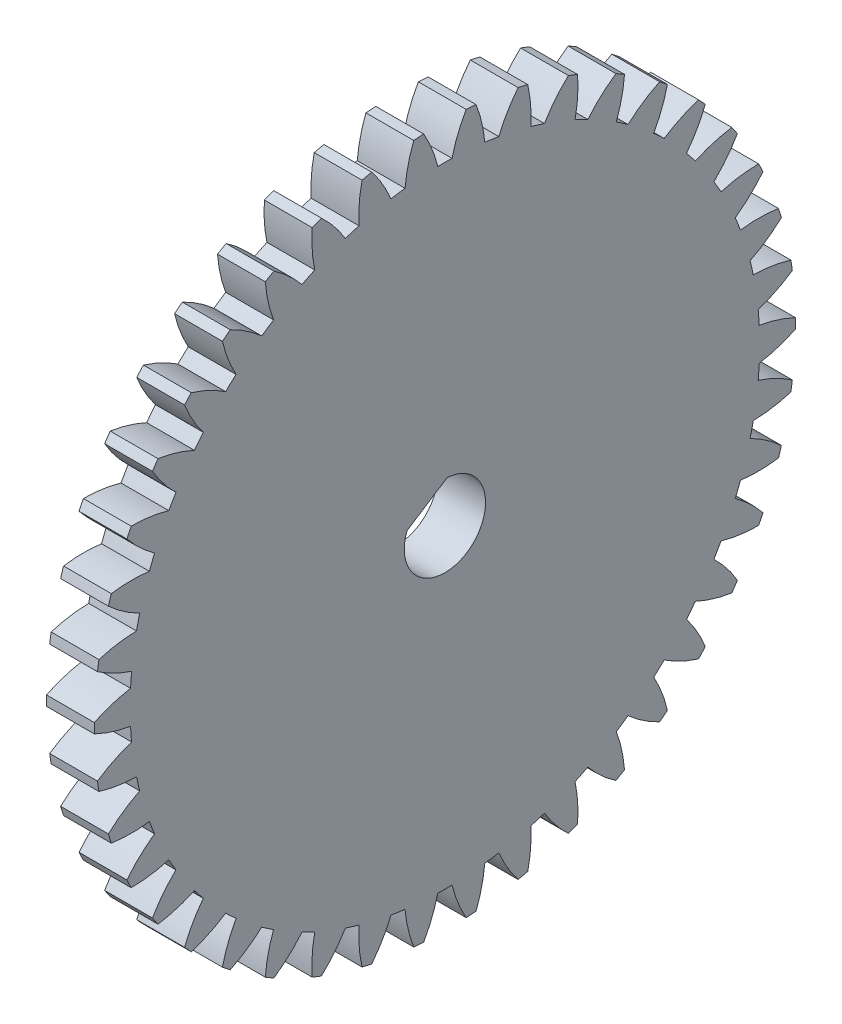
from build123d import *

# Parameters (mm, degrees)
BASPROSKE_W     = 3
BASPROSKE_H     = 22
TOOTHCUT_DEPTH  = 32.256999216
TEETHCUTS_COUNT = 42
TEETHCUTS_ANGLE = 351.428571429
BORE_DEPTH      = 50.0000508


with BuildPart() as part:
    # BasProSke → Base-Revolve (revolve)
    with BuildSketch(Plane(origin=(0, 0, 0), x_dir=(1, 0, 0), z_dir=(0, 1, 0))):
        with Locations((1.5, 11)):
            Rectangle(BASPROSKE_W, BASPROSKE_H)
    revolve(axis=Axis((-10, 0, 0), (1, 0, 0)))

    # TooCutSke → ToothCut (cut, through all)
    with BuildSketch(Plane(origin=(0, 0, 0), x_dir=(0, 0, -1), z_dir=(1, 0, 0))):
        with BuildLine():
            ThreePointArc((0.446078735, 19.743961476), (0, 19.749), (-0.446078735, 19.743961476))
            ThreePointArc((-0.446078735, 19.743961476), (-0.816459964, 20.896623713), (-1.348697399, 21.984068333))
            ThreePointArc((-1.348697399, 21.984068333), (0, 22.0254), (1.348697399, 21.984068333))
            ThreePointArc((1.348697399, 21.984068333), (0.816459964, 20.896623713), (0.446078735, 19.743961476))
        make_face()
    toothcut = extrude(amount=TOOTHCUT_DEPTH, mode=Mode.SUBTRACT)

    # TeethCuts: ToothCut ×42 about axis
    teethcuts_axis = Axis((-10, 0, 0), (1, 0, 0))
    for i in range(1, TEETHCUTS_COUNT):
        add(toothcut.rotate(teethcuts_axis, i * TEETHCUTS_ANGLE / (TEETHCUTS_COUNT - 1)), mode=Mode.SUBTRACT)

    # BorSke → Bore (cut, symmetric)
    with BuildSketch(Plane(origin=(0, 0, 0), x_dir=(0, 0, -1), z_dir=(1, 0, 0))):
        with BuildLine():
            Line((-2.380025775, 0.915411007), (0.137972733, 2.546264622))
            ThreePointArc((0.137972733, 2.546264622), (1.386225573, -2.140298732), (-2.380025775, 0.915411007))
        make_face()
    extrude(amount=BORE_DEPTH, both=True, mode=Mode.SUBTRACT)


solid = part.part
